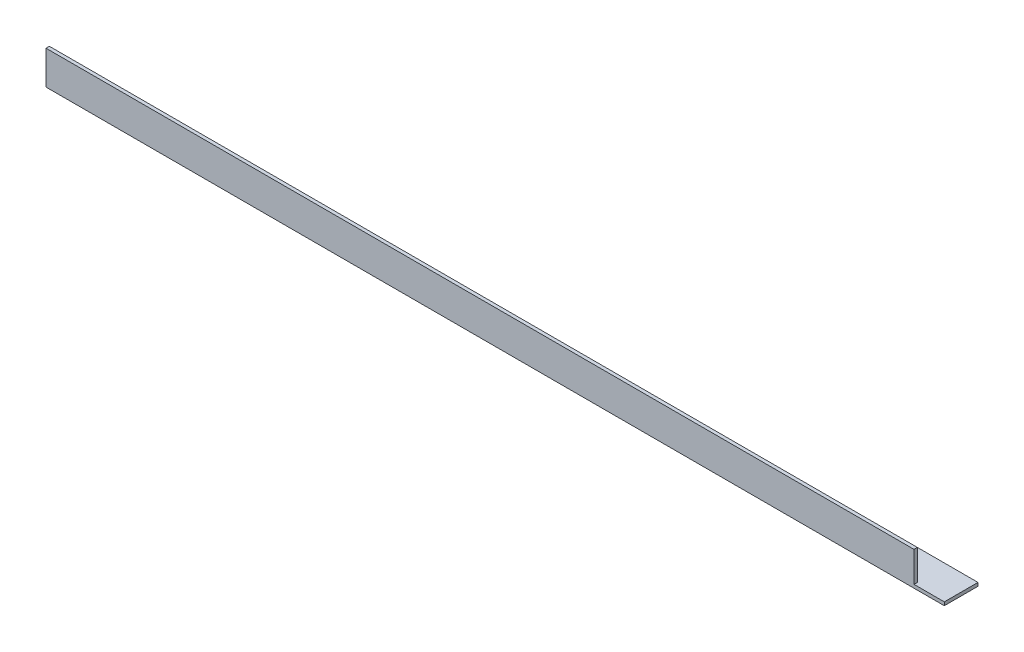
from build123d import *

# Parameters (mm, degrees)
EXTRUDE_1_DEPTH     = 800
CUT_EXTRUDE_1_REACH = 803.124
SKETCH_2_W          = 27
SKETCH_2_H          = 27


with BuildPart() as part:
    # Эскиз1 → Вытянуть-Тонкостенный1 (new body)
    with BuildSketch(Plane(origin=(0, 0, 0), x_dir=(0, 0, -1), z_dir=(1, 0, 0))):
        Polygon((0, 30), (0, 0), (30, 0), (30, 3), (3, 3), (3, 30), align=None)
    extrude(amount=EXTRUDE_1_DEPTH)

    # Эскиз2 → Вырез-Вытянуть1 (cut, up to next)
    with BuildSketch(Plane.XY, mode=Mode.PRIVATE) as cut_extrude_1_sk1:
        with Locations((786.5, 16.5)):
            Rectangle(SKETCH_2_W, SKETCH_2_H)
    cut_extrude_1_tool1 = extrude(cut_extrude_1_sk1.sketch, amount=-CUT_EXTRUDE_1_REACH, mode=Mode.PRIVATE) & part.part
    add(cut_extrude_1_tool1.solids().sort_by_distance((786.5, 16.5, 0))[0], mode=Mode.SUBTRACT)


solid = part.part
